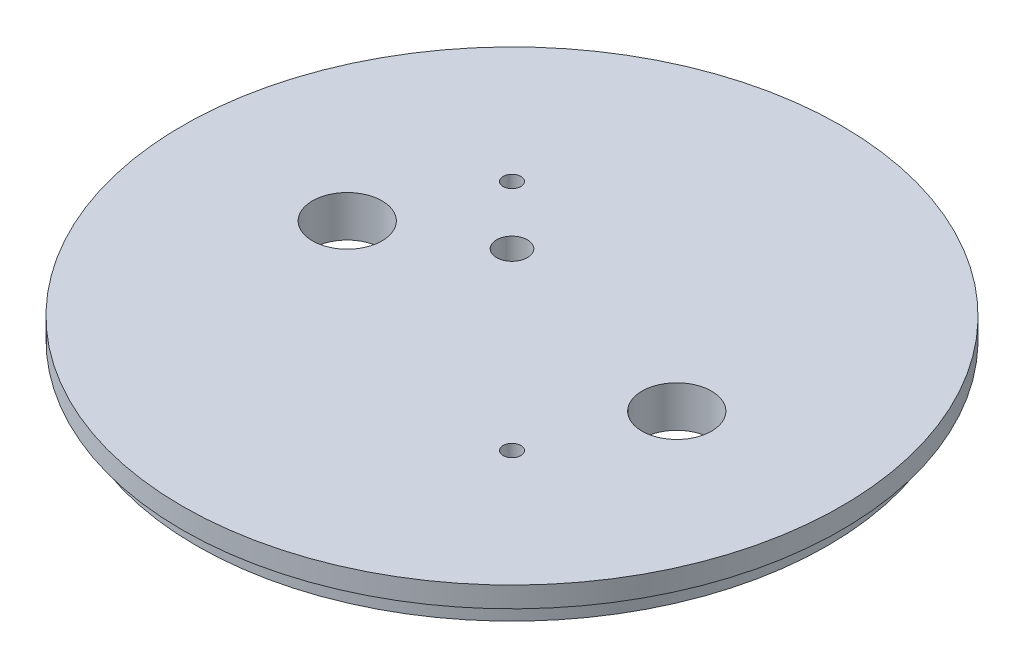
from build123d import *

# Parameters (mm, degrees)
SKETCH1_R           = 50.8
SKETCH1_R_2         = 5.3578125
SKETCH1_R_3         = 1.3589
SKETCH1_R_4         = 2.38125
BOSS_EXTRUDE1_DEPTH = 6.35
SKETCH2_R           = 50.8
SKETCH2_R_2         = 48.641
CUT_EXTRUDE1_DEPTH  = 3.175
CUT_EXTRUDE2_START  = -2.794
CUT_EXTRUDE2_DEPTH  = 3.556


with BuildPart() as part:
    # Sketch1 → Boss-Extrude1 (new body)
    with BuildSketch(Plane(origin=(0, 0, 0), x_dir=(1, 0, 0), z_dir=(0, 1, 0))):
        Circle(SKETCH1_R)
        with Locations((25.4, 0)):
            Circle(SKETCH1_R_2, mode=Mode.SUBTRACT)
        with Locations((-25.4, 0)):
            Circle(SKETCH1_R_2, mode=Mode.SUBTRACT)
        with Locations((-17.960512242, 17.960512242)):
            Circle(SKETCH1_R_3, mode=Mode.SUBTRACT)
        with Locations((17.960512242, -17.960512242)):
            Circle(SKETCH1_R_3, mode=Mode.SUBTRACT)
        with Locations((-8.980256121, 8.980256121)):
            Circle(SKETCH1_R_4, mode=Mode.SUBTRACT)
    extrude(amount=BOSS_EXTRUDE1_DEPTH)

    # Sketch2 → Cut-Extrude1 (cut)
    with BuildSketch(Plane.XZ):
        Circle(SKETCH2_R)
        Circle(SKETCH2_R_2, mode=Mode.SUBTRACT)
    extrude(amount=-CUT_EXTRUDE1_DEPTH, mode=Mode.SUBTRACT)

    # Sketch3 → Cut-Extrude2 (cut)
    with BuildSketch(Plane(origin=(0, 6.35, 0), x_dir=(1, 0, 0), z_dir=(0, 1, 0)).offset(CUT_EXTRUDE2_START)):
        with BuildLine():
            Line((3.2385, 34.798), (3.2385, 13.97))
            ThreePointArc((3.2385, 13.97), (0, 10.7315), (-3.2385, 13.97))
            Line((-3.2385, 13.97), (-3.2385, 34.798))
            ThreePointArc((-3.2385, 34.798), (0, 38.0365), (3.2385, 34.798))
        make_face()
        with BuildLine():
            Line((3.2385, -34.798), (3.2385, -13.97))
            ThreePointArc((3.2385, -13.97), (0, -10.7315), (-3.2385, -13.97))
            Line((-3.2385, -13.97), (-3.2385, -34.798))
            ThreePointArc((-3.2385, -34.798), (0, -38.0365), (3.2385, -34.798))
        make_face()
    extrude(amount=-CUT_EXTRUDE2_DEPTH, mode=Mode.SUBTRACT)


solid = part.part
